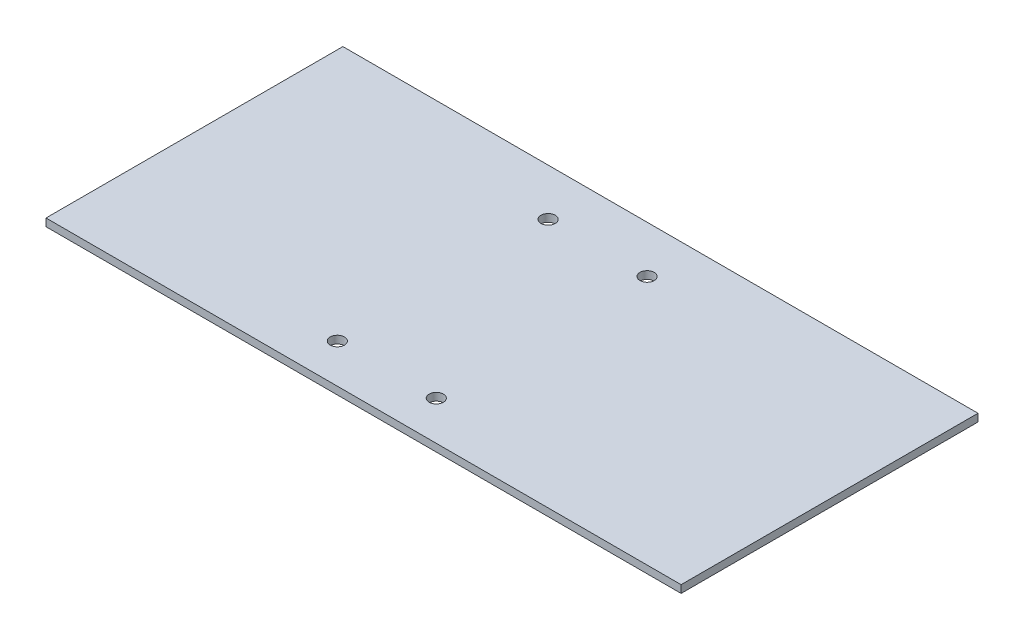
from build123d import *

# Parameters (mm, degrees)
SKETCH1_W           = 101.8800096
SKETCH1_H           = 47.62500254
BOSS_EXTRUDE1_DEPTH = 1.2192
CUT_EXTRUDE1_REACH  = 114.469
SKETCH5_R           = 1.143
CUT_EXTRUDE2_REACH  = 114.469
SKETCH6_R           = 1.143


with BuildPart() as part:
    # Sketch1 → Boss-Extrude1 (new body)
    with BuildSketch(Plane(origin=(0, 0, 0), x_dir=(1, 0, 0), z_dir=(0, 1, 0))):
        with Locations((50.9400048, -23.81250127)):
            Rectangle(SKETCH1_W, SKETCH1_H)
    extrude(amount=BOSS_EXTRUDE1_DEPTH)

    # Sketch5 → Cut-Extrude1 (cut, up to next)
    with BuildSketch(Plane(origin=(0, 1.2192, 0), x_dir=(1, 0, 0), z_dir=(0, 1, 0)), mode=Mode.PRIVATE) as cut_extrude1_sk1:
        with Locations((56.3375, -7.540625)):
            Circle(SKETCH5_R)
    cut_extrude1_tool1 = extrude(cut_extrude1_sk1.sketch, amount=-CUT_EXTRUDE1_REACH, mode=Mode.PRIVATE) & part.part
    # Sketch5 → Cut-Extrude1 (cut, up to next)
    with BuildSketch(Plane(origin=(0, 1.2192, 0), x_dir=(1, 0, 0), z_dir=(0, 1, 0)), mode=Mode.PRIVATE) as cut_extrude1_sk2:
        with Locations((40.4625, -7.540625)):
            Circle(SKETCH5_R)
    cut_extrude1_tool2 = extrude(cut_extrude1_sk2.sketch, amount=-CUT_EXTRUDE1_REACH, mode=Mode.PRIVATE) & part.part
    add(cut_extrude1_tool1.solids().sort_by_distance((56.3375, 1.2192, 7.540625))[0], mode=Mode.SUBTRACT)
    add(cut_extrude1_tool2.solids().sort_by_distance((40.4625, 1.2192, 7.540625))[0], mode=Mode.SUBTRACT)

    # Sketch6 → Cut-Extrude2 (cut, up to next)
    with BuildSketch(Plane(origin=(0, 1.2192, 0), x_dir=(1, 0, 0), z_dir=(0, 1, 0)), mode=Mode.PRIVATE) as cut_extrude2_sk1:
        with Locations((56.3375, -41.35437754)):
            Circle(SKETCH6_R)
    cut_extrude2_tool1 = extrude(cut_extrude2_sk1.sketch, amount=-CUT_EXTRUDE2_REACH, mode=Mode.PRIVATE) & part.part
    # Sketch6 → Cut-Extrude2 (cut, up to next)
    with BuildSketch(Plane(origin=(0, 1.2192, 0), x_dir=(1, 0, 0), z_dir=(0, 1, 0)), mode=Mode.PRIVATE) as cut_extrude2_sk2:
        with Locations((40.4625, -41.35437754)):
            Circle(SKETCH6_R)
    cut_extrude2_tool2 = extrude(cut_extrude2_sk2.sketch, amount=-CUT_EXTRUDE2_REACH, mode=Mode.PRIVATE) & part.part
    add(cut_extrude2_tool1.solids().sort_by_distance((56.3375, 1.2192, 41.354378))[0], mode=Mode.SUBTRACT)
    add(cut_extrude2_tool2.solids().sort_by_distance((40.4625, 1.2192, 41.354378))[0], mode=Mode.SUBTRACT)


solid = part.part
